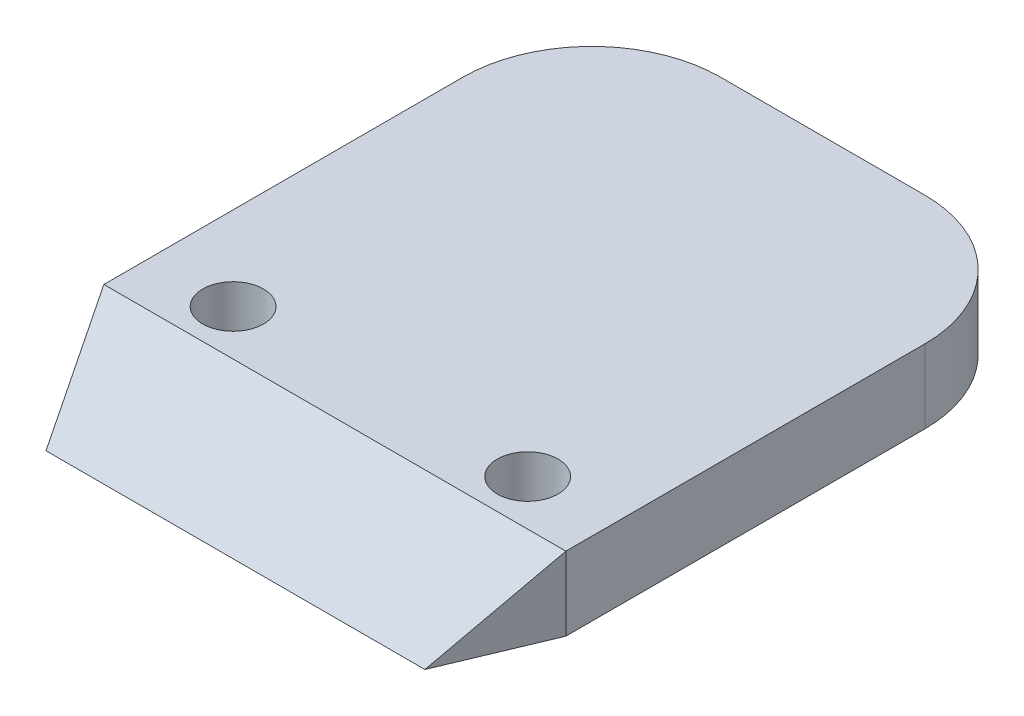
from build123d import *
from OCP.BRepFilletAPI import BRepFilletAPI_MakeChamfer

# Parameters (mm, degrees)
SKETCH4_W                = 12.46
SKETCH4_H                = 17.25
BOSS_EXTRUDE3_DEPTH      = 6
BOSS_EXTRUDE6_DEPTH      = 7.3
BOSS_EXTRUDE6_DEPTH_BACK = 17.25
SKETCH8_R                = 12.546781182
SKETCH8_R_2              = 11.15
BOSS_EXTRUDE4_DEPTH      = 17.25
SKETCH6_R                = 2
CUT_EXTRUDE1_DEPTH       = 5
CHAMFER1_SIZE            = 0.5
CHAMFER1_SIZE_2          = 0.866025404
SKETCH10_W               = 12.46
SKETCH10_H               = 23.7
CUT_EXTRUDE3_DEPTH       = 17.25
CUT_EXTRUDE4_REACH       = 43.938
SKETCH11_W               = 5
SKETCH11_H               = 3
BOSS_EXTRUDE7_START      = -7.3
BOSS_EXTRUDE7_DEPTH      = 7.3
BOSS_EXTRUDE9_START      = 10
BOSS_EXTRUDE9_DEPTH      = 10
BOSS_EXTRUDE10_DEPTH     = 25.093562364
SKETCH18_W               = 21.5
SKETCH18_H               = 12.438292938
CUT_EXTRUDE5_DEPTH       = 2
CUT_EXTRUDE6_DEPTH       = 58.154608998
CUT_EXTRUDE6_DEPTH_BACK  = 58.154608998
SKETCH19_R               = 3.5
FILLET1_R                = 7
CUT_EXTRUDE7_DEPTH       = 55.97840444
CUT_EXTRUDE7_DEPTH_BACK  = 55.97840444
SKETCH20_W               = 25.093562364
SKETCH20_H               = 36.096781182
BOSS_EXTRUDE11_DEPTH     = 44.5
CUT_EXTRUDE8_DEPTH       = 40.401576339
CUT_EXTRUDE8_DEPTH_BACK  = 40.401576339
CUT_EXTRUDE9_DEPTH       = 40.401576339
SKETCH24_R               = 6.5
BOSS_EXTRUDE12_DEPTH     = 5
SKETCH25_R               = 6.075
BOSS_EXTRUDE13_DEPTH     = 5
FILLET2_R                = 1
BOSS_EXTRUDE14_DEPTH     = 2
CUT_EXTRUDE10_REACH      = 57.104
SKETCH27_R               = 0.75
CUT_EXTRUDE11_DEPTH      = 45.983908275
CUT_EXTRUDE11_DEPTH_BACK = 45.983908275
CUT_EXTRUDE12_DEPTH      = 30.927775026
CUT_EXTRUDE12_DEPTH_BACK = 30.927775026
SKETCH29_R               = 1.65
SKETCH30_R               = 2.25
BOSS_EXTRUDE15_DEPTH     = 6
FILLET3_R                = 1


with BuildPart() as part:
    # Sketch4 → Boss-Extrude3 (new body)
    with BuildSketch(Plane.XY):
        with Locations((0, -1.35)):
            Rectangle(SKETCH4_W, SKETCH4_H)
    extrude(amount=BOSS_EXTRUDE3_DEPTH)



with BuildPart() as body_2:
    # Sketch8 → Boss-Extrude6 (new, two sides: drawn at the far end of the back side and taken through both)
    with BuildSketch(Plane(origin=(0, -9.975, 0), x_dir=(-1, 0, 0), z_dir=(0, -1, 0)).offset(-BOSS_EXTRUDE6_DEPTH_BACK)):
        with Locations(Location((0, -23.55, 0), (0, 0, 90))):
            Circle(SKETCH8_R)
        with Locations(Location((0, -23.55, 0), (0, 0, 90))):
            Circle(SKETCH8_R_2, mode=Mode.SUBTRACT)
    extrude(amount=BOSS_EXTRUDE6_DEPTH + BOSS_EXTRUDE6_DEPTH_BACK)


with BuildPart() as part_1:
    add(part.part)

    add(body_2.part)  # Boss-Extrude4 merges body 2
    # Sketch5 → Boss-Extrude4 (add)
    with BuildSketch(Plane(origin=(0, 7.275, 0), x_dir=(1, 0, 0), z_dir=(0, 1, 0))):
        with BuildLine():
            Line((12.546781182, -23.55), (12.546781182, 0))
            Line((12.546781182, 0), (6.23, 0))
            Line((6.23, 0), (6.23, -29.7))
            Line((6.23, -29.7), (-6.23, -29.7))
            Line((-6.23, -29.7), (-6.23, 0))
            Line((-6.23, 0), (-12.546781182, 0))
            Line((-12.546781182, 0), (-12.546781182, -23.55))
            ThreePointArc((-12.546781182, -23.55), (0, -36.096781182), (12.546781182, -23.55))
        make_face()
    extrude(amount=-BOSS_EXTRUDE4_DEPTH)

    # Sketch6 → Cut-Extrude1 (cut)
    with BuildSketch(Plane(origin=(0, 7.275, 0), x_dir=(1, 0, 0), z_dir=(0, 1, 0))):
        with Locations(Location((0, -3.5, 0), (0, 0, 270))):
            Circle(SKETCH6_R)
        with Locations(Location((0, -32.2, 0), (0, 0, 270))):
            Circle(SKETCH6_R)
    extrude(amount=-CUT_EXTRUDE1_DEPTH, mode=Mode.SUBTRACT)

    # Chamfer1
    chamfer1_edges_1 = [part_1.edges().sort_by_distance(p)[0] for p in [
        (0, 7.275, 1.5),
    ]]
    chamfer1_side_1 = [part_1.faces().sort_by_distance(p)[0] for p in [
        (0, 7.275, 1.49),
    ]]
    chamfer1_edges_2 = [part_1.edges().sort_by_distance(p)[0] for p in [
        (0, 7.275, 30.2),
    ]]
    chamfer1_side_2 = [part_1.faces().sort_by_distance(p)[0] for p in [
        (0, 7.275, 30.19),
    ]]
    chamfer1 = BRepFilletAPI_MakeChamfer(part_1.part.solid().wrapped)
    for e in chamfer1_edges_1:
        chamfer1.Add(CHAMFER1_SIZE - 0.0001, CHAMFER1_SIZE_2 - 0.0001, e.wrapped, chamfer1_side_1[0].wrapped)
    for e in chamfer1_edges_2:
        chamfer1.Add(CHAMFER1_SIZE - 0.0001, CHAMFER1_SIZE_2 - 0.0001, e.wrapped, chamfer1_side_2[0].wrapped)
    add(Compound.cast(chamfer1.Shape()), mode=Mode.REPLACE)  # a hair under: the kernel refuses the full size

    # Sketch10 → Cut-Extrude3 (cut)
    with BuildSketch(Plane(origin=(0, 7.275, 0), x_dir=(1, 0, 0), z_dir=(0, 1, 0))):
        with Locations((0, -17.85)):
            Rectangle(SKETCH10_W, SKETCH10_H)
    extrude(amount=-CUT_EXTRUDE3_DEPTH, mode=Mode.SUBTRACT)

    # Sketch11 → Cut-Extrude4 (cut, up to next)
    with BuildSketch(Plane.XY.offset(36.096781182), mode=Mode.PRIVATE) as cut_extrude4_sk1:
        with Locations((0, -8.475)):
            Rectangle(SKETCH11_W, SKETCH11_H)
    cut_extrude4_tool1 = extrude(cut_extrude4_sk1.sketch, amount=-CUT_EXTRUDE4_REACH, mode=Mode.PRIVATE) & part_1.part
    add(cut_extrude4_tool1.solids().sort_by_distance((0, -8.475, 36.096781))[0], mode=Mode.SUBTRACT)

    # Sketch13 → Boss-Extrude7 (add)
    with BuildSketch(Plane.XZ.offset(17.275).offset(BOSS_EXTRUDE7_START)):
        with BuildLine():
            Line((-12.546781182, 23.55), (-12.546781182, 0))
            Line((-12.546781182, 0), (12.546781182, 0))
            Line((12.546781182, 0), (12.546781182, 23.55))
            ThreePointArc((12.546781182, 23.55), (0, 11.003218818), (-12.546781182, 23.55))
        make_face()
    extrude(amount=BOSS_EXTRUDE7_DEPTH)

    # Sketch15 → Boss-Extrude9 (add)
    with BuildSketch(Plane(origin=(0, 7.275, 0), x_dir=(1, 0, 0), z_dir=(0, 1, 0)).offset(BOSS_EXTRUDE9_START)):
        with BuildLine():
            Line((-12.546781182, 0), (12.546781182, 0))
            Line((12.546781182, 0), (12.546781182, -23.55))
            ThreePointArc((12.546781182, -23.55), (0, -36.096781182), (-12.546781182, -23.55))
            Line((-12.546781182, -23.55), (-12.546781182, 0))
        make_face()
        with BuildLine():
            Line((-6.23, -0.8), (6.23, -0.8))
            Line((6.23, -0.8), (6.23, -33.5))
            ThreePointArc((6.23, -33.5), (5.937106781, -34.207106781), (5.23, -34.5))
            Line((5.23, -34.5), (-5.23, -34.5))
            ThreePointArc((-5.23, -34.5), (-5.937106781, -34.207106781), (-6.23, -33.5))
            Line((-6.23, -33.5), (-6.23, -0.8))
        make_face(mode=Mode.SUBTRACT)
    extrude(amount=-BOSS_EXTRUDE9_DEPTH)

    # Sketch17 → Boss-Extrude10 (add)
    with BuildSketch(Plane(origin=(-12.546781182, 4.728218818, 0), x_dir=(0, -1, 0), z_dir=(1, 0, 0))):
        Polygon((26.978218818, 26.5), (26.978218818, 0), (-17.521781182, 0), (-17.521781182, 26.5), (-13.521781182, 26.5), (-13.521781182, 5), (22.978218818, 5), (22.978218818, 26.5), align=None)
    extrude(amount=BOSS_EXTRUDE10_DEPTH)

    # Sketch18 → Cut-Extrude5 (cut)
    with BuildSketch(Plane.ZX.offset(-18.25)):
        with Locations((-15.75, 0)):
            Rectangle(SKETCH18_W, SKETCH18_H)
    extrude(amount=-CUT_EXTRUDE5_DEPTH, mode=Mode.SUBTRACT)

    # Sketch19 → Cut-Extrude6 (cut, two sides: drawn at the far end of the back side and taken through both)
    with BuildSketch(Plane.ZX.offset(-20.25).offset(-CUT_EXTRUDE6_DEPTH_BACK)):
        with Locations((-20, 0)):
            Circle(SKETCH19_R)
    extrude(amount=CUT_EXTRUDE6_DEPTH + CUT_EXTRUDE6_DEPTH_BACK, mode=Mode.SUBTRACT)

    # Fillet1
    fillet1_edges = [part_1.edges().sort_by_distance(p)[0] for p in [
        (12.546781182, -20.25, -26.5),
        (-12.546781182, -20.25, -26.5),
        (-12.546781182, 20.25, -26.5),
        (12.546781182, 20.25, -26.5),
    ]]
    fillet(fillet1_edges, radius=FILLET1_R)

    # Sketch20 → Cut-Extrude7 (cut, two sides: drawn at the far end of the back side and taken through both)
    with BuildSketch(Plane(origin=(0, 17.275, 0), x_dir=(1, 0, 0), z_dir=(0, 1, 0)).offset(-CUT_EXTRUDE7_DEPTH_BACK)):
        with Locations((0, -18.048390591)):
            Rectangle(SKETCH20_W, SKETCH20_H)
    extrude(amount=CUT_EXTRUDE7_DEPTH + CUT_EXTRUDE7_DEPTH_BACK, mode=Mode.SUBTRACT)

    # Sketch21 → Boss-Extrude11 (add)
    with BuildSketch(Plane(origin=(0, 22.25, 0), x_dir=(1, 0, 0), z_dir=(0, 1, 0))):
        Polygon((12.546781182, 0), (-0.025415104, -30), (-12.546781182, 0), align=None)
    extrude(amount=-BOSS_EXTRUDE11_DEPTH)

    # Sketch22 → Cut-Extrude8 (cut, two sides: drawn at the far end of the back side and taken through both)
    with BuildSketch(Plane(origin=(0, 0, 0), x_dir=(0, 0, -1), z_dir=(1, 0, 0)).offset(-CUT_EXTRUDE8_DEPTH_BACK)):
        Polygon((0, 22.25), (-30, 0.01), (-30, 22.25), align=None)
        Polygon((0, -22.25), (-30, -22.25), (-30, -0.01), align=None)
    extrude(amount=CUT_EXTRUDE8_DEPTH + CUT_EXTRUDE8_DEPTH_BACK, mode=Mode.SUBTRACT)

    # Sketch23 → Cut-Extrude9 (cut, through all)
    with BuildSketch(Plane(origin=(0, 0, 0), x_dir=(-1, 0, 0), z_dir=(0, 0, -1))):
        Polygon((12.546781182, 18.25), (0, 0), (12.546781182, -22.25), align=None)
    extrude(amount=-CUT_EXTRUDE9_DEPTH, mode=Mode.SUBTRACT)

    # Sketch24 → Boss-Extrude12 (add)
    with BuildSketch(Plane(origin=(0, 22.25, 0), x_dir=(1, 0, 0), z_dir=(0, 1, 0))):
        with Locations(Location((0, 20, 0), (0, 0, 270))):
            Circle(SKETCH24_R)
    extrude(amount=-BOSS_EXTRUDE12_DEPTH)

    # Sketch25 → Boss-Extrude13 (add)
    with BuildSketch(Plane.XZ.offset(-17.25)):
        with Locations(Location((0, -20, 0), (0, 0, 270))):
            Circle(SKETCH25_R)
    extrude(amount=BOSS_EXTRUDE13_DEPTH)

    # Fillet2
    fillet2_edges = [part_1.edges().sort_by_distance(p)[0] for p in [
        (0, 12.25, -13.925),
    ]]
    fillet(fillet2_edges, radius=FILLET2_R)

    # Sketch26 → Boss-Extrude14 (add)
    with BuildSketch(Plane(origin=(0, -20.25, 0), x_dir=(1, 0, 0), z_dir=(0, 1, 0))):
        Polygon((-6.219146469, 5), (-2.5, 5), (-3.1585, 20), (-3.44385, 26.5), (-6.219146469, 26.5), align=None)
        Polygon((3.1585, 20), (3.44385, 26.5), (6.219146469, 26.5), (6.219146469, 5), (2.5, 5), align=None)
    extrude(amount=BOSS_EXTRUDE14_DEPTH)

    # Sketch27 → Cut-Extrude10 (cut, up to next)
    with BuildSketch(Plane.XZ.offset(22.25), mode=Mode.PRIVATE) as cut_extrude10_sk1:
        with Locations(Location((0, -10, 0), (0, 0, 270))):
            Circle(SKETCH27_R)
    cut_extrude10_tool1 = extrude(cut_extrude10_sk1.sketch, amount=-CUT_EXTRUDE10_REACH, mode=Mode.PRIVATE) & part_1.part
    # Sketch27 → Cut-Extrude10 (cut, up to next)
    with BuildSketch(Plane.XZ.offset(22.25), mode=Mode.PRIVATE) as cut_extrude10_sk2:
        with Locations(Location((0, -7.5, 0), (0, 0, 270))):
            Circle(SKETCH27_R)
    cut_extrude10_tool2 = extrude(cut_extrude10_sk2.sketch, amount=-CUT_EXTRUDE10_REACH, mode=Mode.PRIVATE) & part_1.part
    # Sketch27 → Cut-Extrude10 (cut, up to next)
    with BuildSketch(Plane.XZ.offset(22.25), mode=Mode.PRIVATE) as cut_extrude10_sk3:
        with Locations(Location((0, -12.5, 0), (0, 0, 270))):
            Circle(SKETCH27_R)
    cut_extrude10_tool3 = extrude(cut_extrude10_sk3.sketch, amount=-CUT_EXTRUDE10_REACH, mode=Mode.PRIVATE) & part_1.part
    add(cut_extrude10_tool1.solids().sort_by_distance((0, -22.25, -10))[0], mode=Mode.SUBTRACT)
    add(cut_extrude10_tool2.solids().sort_by_distance((0, -22.25, -7.5))[0], mode=Mode.SUBTRACT)
    add(cut_extrude10_tool3.solids().sort_by_distance((0, -22.25, -12.5))[0], mode=Mode.SUBTRACT)

    # Sketch28 → Cut-Extrude11 (cut, two sides: drawn at the far end of the back side and taken through both)
    with BuildSketch(Plane(origin=(12.546781182, 0, 0), x_dir=(0, 0, -1), z_dir=(1, 0, 0)).offset(-CUT_EXTRUDE11_DEPTH_BACK)):
        Polygon((5, 18.25), (-35.232883585, 18.25), (-35.232883585, -25.616523732), (31.598677018, -25.616523732), (31.598677018, 10.892065209), (5, 10.892065209), align=None)
    extrude(amount=CUT_EXTRUDE11_DEPTH + CUT_EXTRUDE11_DEPTH_BACK, mode=Mode.SUBTRACT)

    # Sketch29 → Cut-Extrude12 (cut, two sides: drawn at the far end of the back side and taken through both)
    with BuildSketch(Plane.XZ.offset(-18.25).offset(-CUT_EXTRUDE12_DEPTH_BACK)):
        with Locations(Location((-8, -2.473316547, 0), (0, 0, 270))):
            Circle(SKETCH29_R)
        with Locations(Location((8, -2.473316547, 0), (0, 0, 270))):
            Circle(SKETCH29_R)
    extrude(amount=CUT_EXTRUDE12_DEPTH + CUT_EXTRUDE12_DEPTH_BACK, mode=Mode.SUBTRACT)

    # Sketch30 → Boss-Extrude15 (add)
    with BuildSketch(Plane.XZ.offset(-18.25)):
        with Locations(Location((0, -2.473316547, 0), (0, 0, 90))):
            Circle(SKETCH30_R)
    extrude(amount=BOSS_EXTRUDE15_DEPTH)

    # Fillet3
    fillet3_edges = [part_1.edges().sort_by_distance(p)[0] for p in [
        (0, 12.25, -4.723316547),
    ]]
    fillet(fillet3_edges, radius=FILLET3_R)


solid = part_1.part
